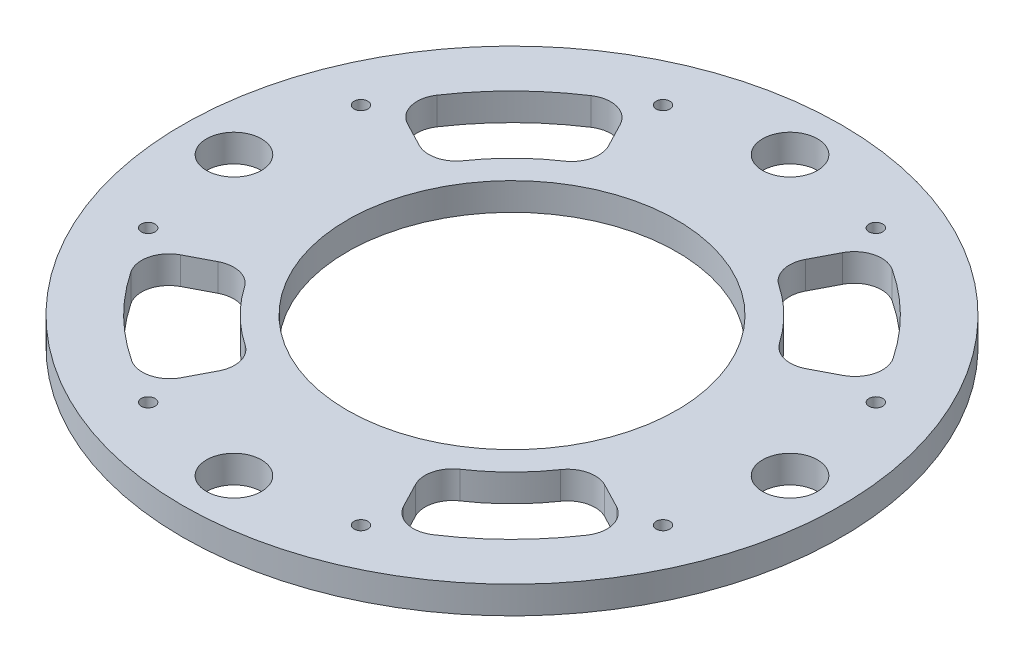
from build123d import *

# Parameters (mm, degrees)
SKETCH1_R           = 76.2
BOSS_EXTRUDE1_DEPTH = 6.35
SKETCH2_R           = 35
CUT_EXTRUDE1_DEPTH  = 6.35
SKETCH3_R           = 6.35
CUT_EXTRUDE2_DEPTH  = 10
SKETCH7_R           = 1.5875
CUT_EXTRUDE4_DEPTH  = 10
SKETCH8_R           = 6.35
CUT_EXTRUDE5_DEPTH  = 10
SKETCH9_R           = 38.1
CUT_EXTRUDE6_DEPTH  = 10
CUT_EXTRUDE10_DEPTH = 10


with BuildPart() as part:
    # Sketch1 → Boss-Extrude1 (new body)
    with BuildSketch(Plane(origin=(0, 0, 0), x_dir=(1, 0, 0), z_dir=(0, 1, 0))):
        Circle(SKETCH1_R)
    extrude(amount=BOSS_EXTRUDE1_DEPTH)

    # Sketch2 → Cut-Extrude1 (cut)
    with BuildSketch(Plane(origin=(0, 6.35, 0), x_dir=(1, 0, 0), z_dir=(0, 1, 0))):
        Circle(SKETCH2_R)
    extrude(amount=-CUT_EXTRUDE1_DEPTH, mode=Mode.SUBTRACT)

    # Sketch3 → Cut-Extrude2 (cut)
    with BuildSketch(Plane(origin=(0, 6.35, 0), x_dir=(1, 0, 0), z_dir=(0, 1, 0))):
        with Locations((-64.2875, 0)):
            Circle(SKETCH3_R)
        with Locations((64.2875, 0)):
            Circle(SKETCH3_R)
    extrude(amount=-CUT_EXTRUDE2_DEPTH, mode=Mode.SUBTRACT)

    # Sketch7 → Cut-Extrude4 (cut)
    with BuildSketch(Plane(origin=(0, 6.35, 0), x_dir=(1, 0, 0), z_dir=(0, 1, 0))):
        with Locations((-24.5999, 59.5249)):
            Circle(SKETCH7_R)
        with Locations((24.5999, 59.5249)):
            Circle(SKETCH7_R)
        with Locations((24.5999, -59.5249)):
            Circle(SKETCH7_R)
        with Locations((-24.5999, -59.5249)):
            Circle(SKETCH7_R)
        with Locations((-59.5249, 24.5999)):
            Circle(SKETCH7_R)
        with Locations((-59.5249, -24.5999)):
            Circle(SKETCH7_R)
        with Locations((59.5249, 24.5999)):
            Circle(SKETCH7_R)
        with Locations((59.5249, -24.5999)):
            Circle(SKETCH7_R)
    extrude(amount=-CUT_EXTRUDE4_DEPTH, mode=Mode.SUBTRACT)

    # Sketch8 → Cut-Extrude5 (cut)
    with BuildSketch(Plane(origin=(0, 6.35, 0), x_dir=(1, 0, 0), z_dir=(0, 1, 0))):
        with Locations((-64.2875, 0)):
            Circle(SKETCH8_R)
        with Locations((64.2875, 0)):
            Circle(SKETCH8_R)
        with Locations((0, -64.2875)):
            Circle(SKETCH8_R)
        with Locations((0, 64.2875)):
            Circle(SKETCH8_R)
    extrude(amount=-CUT_EXTRUDE5_DEPTH, mode=Mode.SUBTRACT)

    # Sketch9 → Cut-Extrude6 (cut)
    with BuildSketch(Plane(origin=(0, 6.35, 0), x_dir=(1, 0, 0), z_dir=(0, 1, 0))):
        Circle(SKETCH9_R)
    extrude(amount=-CUT_EXTRUDE6_DEPTH, mode=Mode.SUBTRACT)

    # Sketch10 → Cut-Extrude10 (cut)
    with BuildSketch(Plane(origin=(0, 6.35, 0), x_dir=(1, 0, 0), z_dir=(0, 1, 0))):
        with BuildLine():
            ThreePointArc((-24.830037796, 36.868302416), (-22.223123282, 40.56995153), (-22.744667262, 45.067306456))
            Line((-22.744667262, 45.067306456), (-25.69340518, 50.731779293))
            ThreePointArc((-25.69340518, 50.731779293), (-29.722021798, 53.943778286), (-34.806582189, 53.110750666))
            ThreePointArc((-34.806582189, 53.110750666), (-44.649726855, 45.151432888), (-52.718528787, 35.397834998))
            ThreePointArc((-52.718528787, 35.397834998), (-53.599643338, 30.28850003), (-50.378779602, 26.225532708))
            Line((-50.378779602, 26.225532708), (-44.706731925, 23.272851578))
            ThreePointArc((-44.706731925, 23.272851578), (-40.248145008, 22.741576978), (-36.552799702, 25.292199073))
            ThreePointArc((-36.552799702, 25.292199073), (-31.232430693, 31.628116811), (-24.830037796, 36.868302416))
        make_face()
        with BuildLine():
            ThreePointArc((36.552799702, 25.292199073), (40.248145008, 22.741576978), (44.706731925, 23.272851578))
            Line((44.706731925, 23.272851578), (50.378779602, 26.225532708))
            ThreePointArc((50.378779602, 26.225532708), (53.599643338, 30.28850003), (52.718528787, 35.397834998))
            ThreePointArc((52.718528787, 35.397834998), (44.649726855, 45.151432888), (34.806582189, 53.110750666))
            ThreePointArc((34.806582189, 53.110750666), (29.722021798, 53.943778286), (25.69340518, 50.731779293))
            Line((25.69340518, 50.731779293), (22.744667262, 45.067306456))
            ThreePointArc((22.744667262, 45.067306456), (22.223123282, 40.56995153), (24.830037796, 36.868302416))
            ThreePointArc((24.830037796, 36.868302416), (31.232430693, 31.628116811), (36.552799702, 25.292199073))
        make_face()
        with BuildLine():
            ThreePointArc((24.830037796, -36.868302416), (22.223123282, -40.56995153), (22.744667262, -45.067306456))
            Line((22.744667262, -45.067306456), (25.69340518, -50.731779293))
            ThreePointArc((25.69340518, -50.731779293), (29.722021798, -53.943778286), (34.806582189, -53.110750666))
            ThreePointArc((34.806582189, -53.110750666), (44.649726855, -45.151432888), (52.718528787, -35.397834998))
            ThreePointArc((52.718528787, -35.397834998), (53.599643338, -30.28850003), (50.378779602, -26.225532708))
            Line((50.378779602, -26.225532708), (44.706731925, -23.272851578))
            ThreePointArc((44.706731925, -23.272851578), (40.248145008, -22.741576978), (36.552799702, -25.292199073))
            ThreePointArc((36.552799702, -25.292199073), (31.232430693, -31.628116811), (24.830037796, -36.868302416))
        make_face()
        with BuildLine():
            ThreePointArc((-36.552799702, -25.292199073), (-40.248145008, -22.741576978), (-44.706731925, -23.272851578))
            Line((-44.706731925, -23.272851578), (-50.378779602, -26.225532708))
            ThreePointArc((-50.378779602, -26.225532708), (-53.599643338, -30.28850003), (-52.718528787, -35.397834998))
            ThreePointArc((-52.718528787, -35.397834998), (-44.649726855, -45.151432888), (-34.806582189, -53.110750666))
            ThreePointArc((-34.806582189, -53.110750666), (-29.722021798, -53.943778286), (-25.69340518, -50.731779293))
            Line((-25.69340518, -50.731779293), (-22.744667262, -45.067306456))
            ThreePointArc((-22.744667262, -45.067306456), (-22.223123282, -40.56995153), (-24.830037796, -36.868302416))
            ThreePointArc((-24.830037796, -36.868302416), (-31.232430693, -31.628116811), (-36.552799702, -25.292199073))
        make_face()
    extrude(amount=-CUT_EXTRUDE10_DEPTH, mode=Mode.SUBTRACT)


solid = part.part
